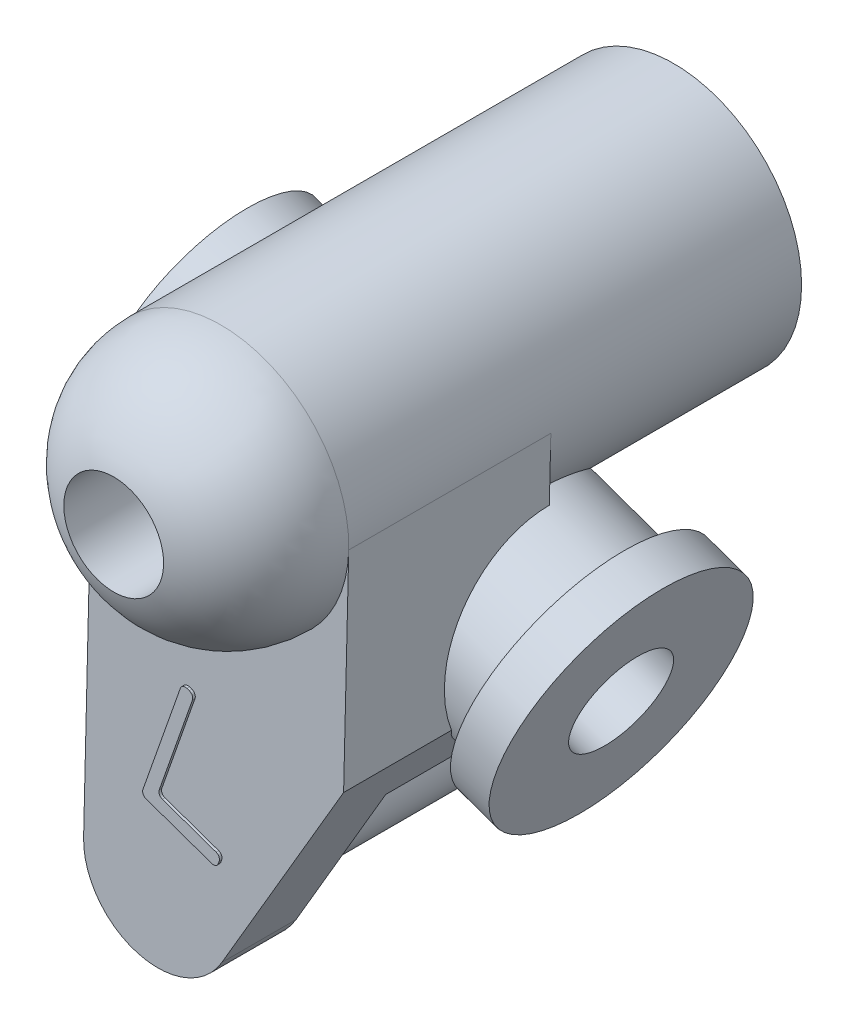
from build123d import *
from build123d.topology import SkipClean

# Parameters (mm, degrees)
BOSS_EXTRU_1_DEPTH       = 1.45
ESQUISSE2_R              = 2.5
BOSS_EXTRU_2_DEPTH       = 2.2
BOSS_EXTRU_3_START       = 7.4
ESQUISSE4_R              = 2.5
BOSS_EXTRU_3_DEPTH       = 11.05
BOSS_EXTRU_4_START       = -1.45
ESQUISSE5_R              = 0.95
BOSS_EXTRU_4_DEPTH       = 7.5
CONG_2_R                 = 2.2
BOSS_EXTRU_5_DEPTH       = 1
BOSS_EXTRU_5_DEPTH_BACK  = 7.45
ENL_V_START              = -5.4
ENL_V_MAT_EXTRU_7_DEPTH  = 5.4
BOSS_EXTRU_14_DEPTH      = 1
BOSS_EXTRU_14_DEPTH_BACK = 7.45
ESQUISSE14_R             = 2
ESQUISSE15_R             = 2.45
BOSS_EXTRU_15_DEPTH      = 0.8
ENL_V_START_2            = -6.05
ESQUISSE16_R             = 3.6
ESQUISSE16_R_2           = 0.95
ENL_V_MAT_EXTRU_9_DEPTH  = 6.05
ESQUISSE17_R             = 0.975
ENL_V_MAT_EXTRU_10_DEPTH = 12.8
ESQUISSE18_R             = 0.975
ENL_V_MAT_EXTRU_11_DEPTH = 12.8
BOSS_EXTRU_16_DEPTH      = 0.05
SCALE1_SCALE             = 6.5


with BuildPart() as part:
    # Esquisse1 → Boss.-Extru.1 (new body)
    with BuildSketch(Plane.XY):
        with BuildLine():
            Line((-2.499269345, 0.060437906), (-2.682459021, -7.514946015))
            ThreePointArc((-2.682459021, -7.514946015), (-1.629243216, -8.944775402), (0.018499188, -8.282491037))
            Line((0.018499188, -8.282491037), (2.398777572, -4.216041966))
            Line((2.398777572, -4.216041966), (2.499269345, -0.060437906))
            ThreePointArc((2.499269345, -0.060437906), (0.060437906, 2.499269345), (-2.499269345, 0.060437906))
        make_face()
    extrude(amount=BOSS_EXTRU_1_DEPTH)

    # Esquisse2 → Boss.-Extru.2 (add)
    with BuildSketch(Plane.XY.offset(1.45)):
        with Locations(Location((0, 0, 0), (0, 0, 178.614730271))):
            Circle(ESQUISSE2_R)
    extrude(amount=BOSS_EXTRU_2_DEPTH)

    # Esquisse4 → Boss.-Extru.3 (add)
    with SkipClean():  # the faces are left unmerged after this step: merging them gives an invalid solid
        with BuildSketch(Plane(origin=(0, 0, 0), x_dir=(-1, 0, 0), z_dir=(0, 0, -1)).offset(BOSS_EXTRU_3_START)):
            with Locations(Location((0, 0, 0), (0, 0, 180))):
                Circle(ESQUISSE4_R)
        extrude(amount=-BOSS_EXTRU_3_DEPTH)
    add(part.part.scale(1), mode=Mode.REPLACE)  # the faces are merged on a copy

    # Esquisse5 → Boss.-Extru.4 (add)
    with SkipClean():  # the faces are left unmerged after this step: merging them gives an invalid solid
        with BuildSketch(Plane(origin=(0, 0, 0), x_dir=(-1, 0, 0), z_dir=(0, 0, -1)).offset(BOSS_EXTRU_4_START)):
            with Locations(Location((1.232882801, -7.55, 0), (0, 0, 180))):
                Circle(ESQUISSE5_R)
        extrude(amount=BOSS_EXTRU_4_DEPTH)

    # Congé2
    cong_2_edges = [part.edges().sort_by_distance(p)[0] for p in [
        (0.030221161, 2.49981733, 3.65),
    ]]
    fillet(cong_2_edges, radius=CONG_2_R - 0.0001)  # a hair under: the kernel refuses the full size

    # Esquisse6 → Boss.-Extru.5 (add, two sides: drawn at the far end of the back side and taken through both)
    with BuildSketch(Plane(origin=(-2.358270057, 0.829796565, 0), x_dir=(0, 0, 1), z_dir=(-0.9433080226536918, 0.3319186261678939, 0)).offset(-BOSS_EXTRU_5_DEPTH_BACK)):
        with BuildLine():
            Line((-2.5, -4.4), (0, -4.4))
            Line((0, -4.4), (0, 1.297884729))
            Line((0, 1.297884729), (-2.5, 1.297884729))
            Line((-2.5, 1.297884729), (-2.5, -0.4))
            ThreePointArc((-2.5, -0.4), (-4.5, -2.4), (-2.5, -4.4))
        make_face()
    extrude(amount=BOSS_EXTRU_5_DEPTH + BOSS_EXTRU_5_DEPTH_BACK)

    # Esquisse13 → Enlèv. mat.-Extru.7 (cut)
    with SkipClean():  # the faces are left unmerged after this step: merging them gives an invalid solid
        with BuildSketch(Plane.XY.offset(ENL_V_START)):
            with BuildLine():
                Line((-1.584775977, 1.933516253), (-2.870785963, 2.386020269))
                Line((-2.870785963, 2.386020269), (-4.762020034, -2.988840108))
                Line((-4.762020034, -2.988840108), (-2.591476667, -3.752581914))
                Line((-2.591476667, -3.752581914), (-2.499269345, 0.060437906))
                ThreePointArc((-2.499269345, 0.060437906), (-2.246544496, 1.096830811), (-1.584775977, 1.933516253))
            make_face()
            with BuildLine():
                Line((1.771456427, -5.28775253), (3.208932757, -5.793552499))
                Line((3.208932757, -5.793552499), (5.100166828, -0.418692123))
                Line((5.100166828, -0.418692123), (2.446360209, 0.515093901))
                ThreePointArc((2.446360209, 0.515093901), (2.489502388, 0.228862104), (2.499269345, -0.060437906))
                Line((2.499269345, -0.060437906), (2.398777572, -4.216041966))
                Line((2.398777572, -4.216041966), (1.771456427, -5.28775253))
            make_face()
        extrude(amount=ENL_V_MAT_EXTRU_7_DEPTH, mode=Mode.SUBTRACT)

    # Esquisse14 → Boss.-Extru.14 (add, two sides: drawn at the far end of the back side and taken through both)
    with BuildSketch(Plane(origin=(-2.358270057, 0.829796565, 0), x_dir=(0, 0, 1), z_dir=(-0.9433080226536918, 0.3319186261678939, 0)).offset(-BOSS_EXTRU_14_DEPTH_BACK)):
        with Locations(Location((-2.5, -2.4, 0), (0, 0, 270))):
            Circle(ESQUISSE14_R)
    extrude(amount=BOSS_EXTRU_14_DEPTH + BOSS_EXTRU_14_DEPTH_BACK)

    # Esquisse15 → Boss.-Extru.15 (add)
    with BuildSketch(Plane(origin=(4.669374712, -1.6429972, 0), x_dir=(0, 0, -1), z_dir=(0.9433080226536918, -0.33191862616789397, 0))):
        with Locations(Location((2.5, -2.4, 0), (0, 0, 90))):
            Circle(ESQUISSE15_R)
    extrude(amount=-BOSS_EXTRU_15_DEPTH)

    # Esquisse16 → Enlèv. mat.-Extru.9 (cut)
    with BuildSketch(Plane(origin=(0, 0, -6.05), x_dir=(-1, 0, 0), z_dir=(0, 0, -1)).offset(ENL_V_START_2)):
        with Locations((1.232882801, -7.55)):
            Circle(ESQUISSE16_R)
        with Locations(Location((1.232882801, -7.55, 0), (0, 0, 180))):
            Circle(ESQUISSE16_R_2, mode=Mode.SUBTRACT)
    extrude(amount=ENL_V_MAT_EXTRU_9_DEPTH, mode=Mode.SUBTRACT)

    # Esquisse17 → Enlèv. mat.-Extru.10 (cut)
    with BuildSketch(Plane(origin=(0, 0, -7.4), x_dir=(-1, 0, 0), z_dir=(0, 0, -1))):
        Circle(ESQUISSE17_R)
    extrude(amount=-ENL_V_MAT_EXTRU_10_DEPTH, mode=Mode.SUBTRACT)

    # Esquisse18 → Enlèv. mat.-Extru.11 (cut)
    with BuildSketch(Plane(origin=(4.669374712, -1.6429972, 0), x_dir=(0, 0, -1), z_dir=(0.9433080226536918, -0.33191862616789397, 0))):
        with Locations(Location((2.5, -2.4, 0), (0, 0, 90))):
            Circle(ESQUISSE18_R)
    extrude(amount=-ENL_V_MAT_EXTRU_11_DEPTH, mode=Mode.SUBTRACT)

    # Esquisse19 → Boss.-Extru.16 (add)
    with BuildSketch(Plane.XY.offset(1.45)):
        with BuildLine():
            Line((-0.741145926, -3.994756307), (-1.473216513, -6.075290521))
            ThreePointArc((-1.473216513, -6.075290521), (-1.469057852, -6.151714142), (-1.412077574, -6.202813186))
            Line((-1.412077574, -6.202813186), (-0.127522665, -6.654805208))
            ThreePointArc((-0.127522665, -6.654805208), (-0.051099043, -6.650646547), (0, -6.593666268))
            Line((0, -6.593666268), (0.016595931, -6.546500867))
            ThreePointArc((0.016595931, -6.546500867), (0.01243727, -6.470077246), (-0.044543008, -6.418978202))
            Line((-0.044543008, -6.418978202), (-1.093270911, -6.049965837))
            ThreePointArc((-1.093270911, -6.049965837), (-1.15025119, -5.998866793), (-1.154409851, -5.922443172))
            Line((-1.154409851, -5.922443172), (-0.50531892, -4.077735963))
            ThreePointArc((-0.50531892, -4.077735963), (-0.509477582, -4.001312342), (-0.56645786, -3.950213298))
            Line((-0.56645786, -3.950213298), (-0.613623261, -3.933617367))
            ThreePointArc((-0.613623261, -3.933617367), (-0.690046883, -3.937776028), (-0.741145926, -3.994756307))
        make_face()
    extrude(amount=BOSS_EXTRU_16_DEPTH)


with BuildPart() as part_1:
    # Scale1: scaled about (-0.062378665, -1.819814111, -1.884608328)
    add(part.part.scale(SCALE1_SCALE).moved(Location((0.343082657, 10.00897761, 10.365345804))))


solid = part_1.part
